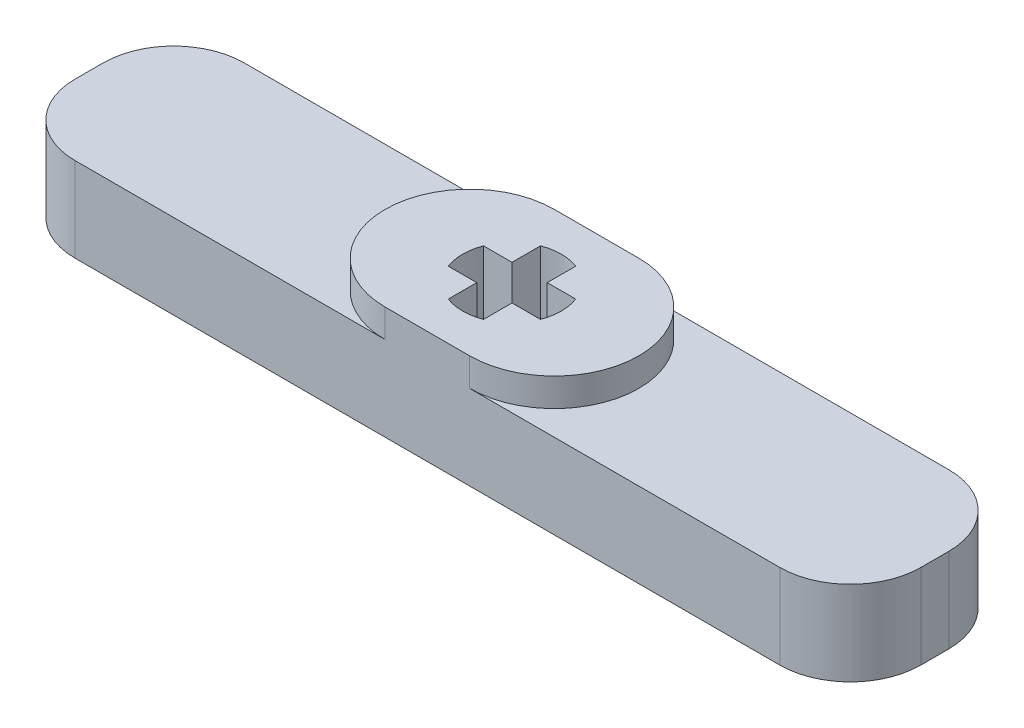
from build123d import *

# Parameters (mm, degrees)
BOSS_EXTRUDE1_DEPTH = 6
BOSS_EXTRUDE2_DEPTH = 2
CUT_EXTRUDE1_DEPTH  = 5


with BuildPart() as part:
    # Sketch1 → Boss-Extrude1 (new body)
    with BuildSketch(Plane(origin=(0, 0, 0), x_dir=(1, 0, 0), z_dir=(0, 1, 0))):
        with BuildLine():
            Line((-25, -6), (25, -6))
            ThreePointArc((25, -6), (28.535533906, -4.535533906), (30, -1))
            Line((30, -1), (30, 1))
            ThreePointArc((30, 1), (28.535533906, 4.535533906), (25, 6))
            Line((25, 6), (-25, 6))
            ThreePointArc((-25, 6), (-28.535533906, 4.535533906), (-30, 1))
            Line((-30, 1), (-30, -1))
            ThreePointArc((-30, -1), (-28.535533906, -4.535533906), (-25, -6))
        make_face()
    extrude(amount=BOSS_EXTRUDE1_DEPTH)

    # Sketch2 → Boss-Extrude2 (add)
    with BuildSketch(Plane(origin=(0, 6, 0), x_dir=(1, 0, 0), z_dir=(0, 1, 0))):
        with BuildLine():
            Line((-3, 6), (3, 6))
            ThreePointArc((3, 6), (9, 0), (3, -6))
            Line((3, -6), (-3, -6))
            ThreePointArc((-3, -6), (-9, 0), (-3, 6))
        make_face()
    extrude(amount=BOSS_EXTRUDE2_DEPTH)

    # Sketch3 → Cut-Extrude1 (cut)
    with BuildSketch(Plane(origin=(0, 8, 0), x_dir=(1, 0, 0), z_dir=(0, 1, 0))):
        with BuildLine():
            Line((1.25, 1.25), (1.25, 3.269174208))
            ThreePointArc((1.25, 3.269174208), (0, 3.5), (-1.25, 3.269174208))
            Line((-1.25, 3.269174208), (-1.25, 1.25))
            Line((-1.25, 1.25), (-3.269174208, 1.25))
            ThreePointArc((-3.269174208, 1.25), (-3.5, 0), (-3.269174208, -1.25))
            Line((-3.269174208, -1.25), (-1.25, -1.25))
            Line((-1.25, -1.25), (-1.25, -3.269174208))
            ThreePointArc((-1.25, -3.269174208), (0, -3.5), (1.25, -3.269174208))
            Line((1.25, -3.269174208), (1.25, -1.25))
            Line((1.25, -1.25), (3.269174208, -1.25))
            ThreePointArc((3.269174208, -1.25), (3.441809824, -0.635566784), (3.5, 0))
            ThreePointArc((3.5, 0), (3.441809824, 0.635566784), (3.269174208, 1.25))
            Line((3.269174208, 1.25), (1.25, 1.25))
        make_face()
    extrude(amount=-CUT_EXTRUDE1_DEPTH, mode=Mode.SUBTRACT)


solid = part.part
